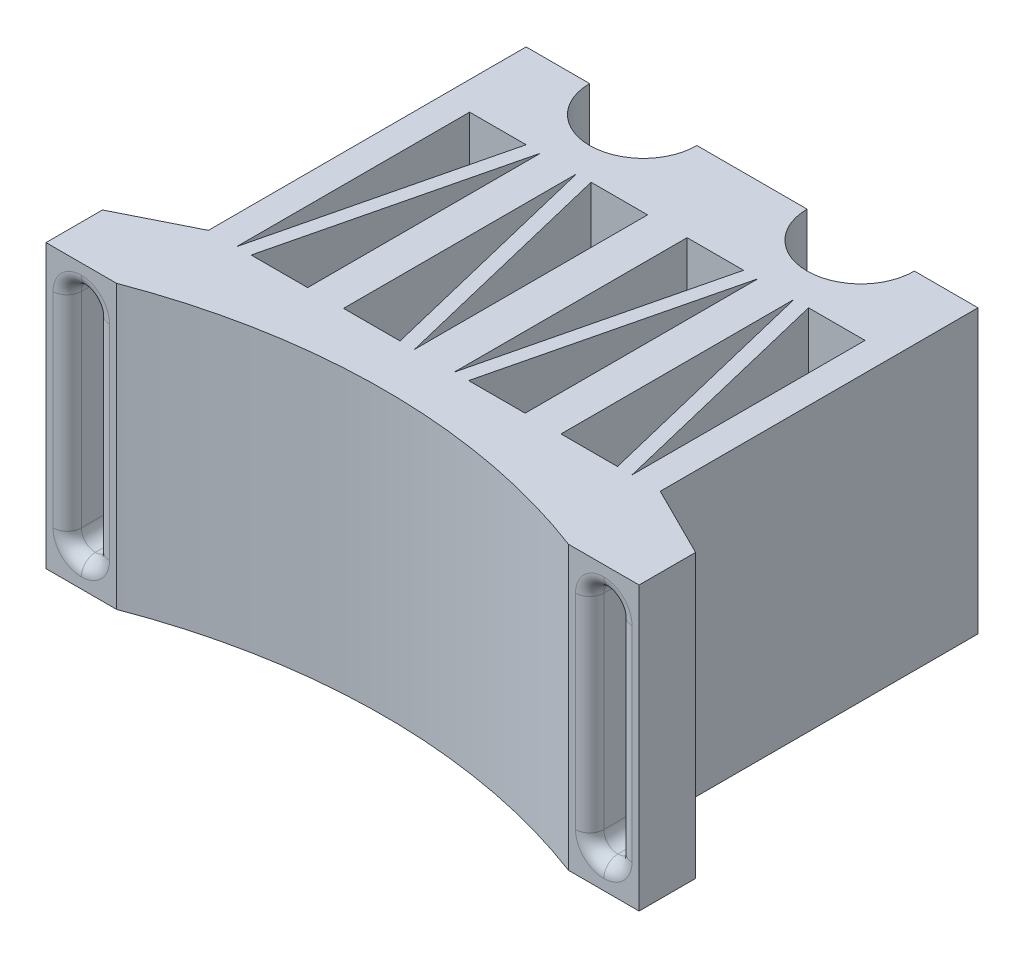
from build123d import *

# Parameters (mm, degrees)
BOSS_EXTRUDE1_DEPTH     = 50.8
SKETCH2_W               = 12.7
SKETCH2_H               = 50.8
SKETCH2_W_2             = 5.08
SKETCH2_H_2             = 41.91
BOSS_EXTRUDE2_DEPTH     = 5.08
CUT_EXTRUDE1_DEPTH      = 130.763924108
CUT_EXTRUDE1_DEPTH_BACK = 130.763924108
SKETCH5_R               = 4.0132
CUT_EXTRUDE2_DEPTH      = 12.7
BOSS_EXTRUDE3_DEPTH     = 50.8
CUT_EXTRUDE4_DEPTH      = 130.763924108
SKETCH10_W              = 5.08
SKETCH10_H              = 41.91
CUT_EXTRUDE5_DEPTH      = 127.949189836
FILLET1_R               = 2.54
FILLET2_R               = 2.54
FILLET3_R               = 2.54


with BuildPart() as part:
    # Sketch1 → Boss-Extrude1 (new body)
    with BuildSketch(Plane(origin=(0, 0, 0), x_dir=(1, 0, 0), z_dir=(0, 1, 0))):
        with BuildLine():
            Line((0, 0), (40.64, 0))
            Line((40.64, 0), (40.64, 73.66))
            Line((40.64, 73.66), (30.734, 73.66))
            ThreePointArc((30.734, 73.66), (21.082, 64.008), (11.43, 73.66))
            Line((11.43, 73.66), (0, 73.66))
            Line((0, 73.66), (0, 0))
        make_face()
        with BuildLine():
            Line((40.64, 73.66), (40.64, 0))
            Line((40.64, 0), (81.28, 0))
            Line((81.28, 0), (81.28, 73.66))
            Line((81.28, 73.66), (69.85, 73.66))
            ThreePointArc((69.85, 73.66), (60.198, 64.008), (50.546, 73.66))
            Line((50.546, 73.66), (40.64, 73.66))
        make_face()
    extrude(amount=BOSS_EXTRUDE1_DEPTH)

    # Sketch2 → Boss-Extrude2 (add)
    with BuildSketch(Plane.XY):
        with Locations((-6.35, 25.4)):
            Rectangle(SKETCH2_W, SKETCH2_H)
        with Locations((-6.35, 25.4)):
            Rectangle(SKETCH2_W_2, SKETCH2_H_2, mode=Mode.SUBTRACT)
    boss_extrude2 = extrude(amount=-BOSS_EXTRUDE2_DEPTH)

    # Mirror3: Boss-Extrude2 across plane
    add(boss_extrude2.mirror(Plane.ZY.offset(-40.64)))

    # Sketch4 → Cut-Extrude1 (cut, two sides: drawn at the far end of the back side and taken through both)
    with BuildSketch(Plane(origin=(0, 50.8, 0), x_dir=(1, 0, 0), z_dir=(0, 1, 0)).offset(-CUT_EXTRUDE1_DEPTH_BACK)):
        with BuildLine():
            Line((313.835320216, -88.467212956), (81.28, 0))
            ThreePointArc((81.28, 0), (40.64, 7.468916508), (0, 0))
            Line((0, 0), (-232.555320216, -88.467212956))
            Line((-232.555320216, -88.467212956), (-232.555320216, -586.095285833))
            Line((-232.555320216, -586.095285833), (313.835320216, -586.095285833))
            Line((313.835320216, -586.095285833), (313.835320216, -88.467212956))
        make_face()
    extrude(amount=CUT_EXTRUDE1_DEPTH + CUT_EXTRUDE1_DEPTH_BACK, mode=Mode.SUBTRACT)

    # Sketch5 → Cut-Extrude2 (cut)
    with BuildSketch(Plane(origin=(0, 0, -73.66), x_dir=(-1, 0, 0), z_dir=(0, 0, -1))):
        with Locations((-40.64, 41.91)):
            Circle(SKETCH5_R)
        with Locations(Location((-40.64, 8.89, 0), (0, 0, 180))):
            Circle(SKETCH5_R)
        with Locations((-40.64, 25.4)):
            Circle(SKETCH5_R)
    extrude(amount=-CUT_EXTRUDE2_DEPTH, mode=Mode.SUBTRACT)

    # Sketch9 → Boss-Extrude3 (add)
    with BuildSketch(Plane(origin=(0, 0, 0), x_dir=(-1, 0, 0), z_dir=(0, -1, 0))):
        Polygon((0, 5.08), (12.7, 5.08), (12.7, 10.16), (0, 16.51), (0, 8.89), align=None)
    boss_extrude3 = extrude(amount=-BOSS_EXTRUDE3_DEPTH)

    # Sketch7 → Cut-Extrude4 (cut, through all)
    with BuildSketch(Plane.XZ):
        Polygon((5.08, -16.51), (5.08, -58.42), (15.24, -58.42), align=None)
        Polygon((7.693571769, -16.51), (17.853571769, -16.51), (17.853571769, -58.42), align=None)
        Polygon((73.586428231, -16.51), (63.426428231, -16.51), (63.426428231, -58.42), align=None)
        Polygon((66.04, -58.42), (76.2, -16.51), (76.2, -58.42), align=None)
        Polygon((24.310428231, -58.42), (34.470428231, -16.51), (24.310428231, -16.51), align=None)
        Polygon((26.924, -58.42), (37.084, -16.51), (37.084, -58.42), align=None)
        Polygon((44.196, -16.51), (44.196, -58.42), (54.356, -58.42), align=None)
        Polygon((56.969571769, -58.42), (46.809571769, -16.51), (56.969571769, -16.51), align=None)
    extrude(amount=-CUT_EXTRUDE4_DEPTH, mode=Mode.SUBTRACT)

    # Sketch10 → Cut-Extrude5 (cut, through all)
    with BuildSketch(Plane.XY.offset(-5.08)):
        with Locations((-6.35, 25.4)):
            Rectangle(SKETCH10_W, SKETCH10_H)
    cut_extrude5 = extrude(amount=-CUT_EXTRUDE5_DEPTH, mode=Mode.SUBTRACT)

    # Fillet1
    fillet1_edges = [part.edges().sort_by_distance(p)[0] for p in [
        (-3.81, 46.355, -7.3025),
        (-8.89, 46.355, -6.0325),
        (-8.89, 4.445, -6.0325),
        (-3.81, 4.445, -7.3025),
    ]]
    fillet(fillet1_edges, radius=FILLET1_R - 0.0001)  # a hair under: the kernel refuses the full size

    # Mirror4: Boss-Extrude3, Cut-Extrude5 across plane
    add(boss_extrude3.mirror(Plane.ZY.offset(-40.64)))
    add(cut_extrude5.mirror(Plane.ZY.offset(-40.64)), mode=Mode.SUBTRACT)

    # Fillet2
    fillet2_edges = [part.edges().sort_by_distance(p)[0] for p in [
        (90.17, 46.355, -6.0325),
        (85.09, 46.355, -7.3025),
        (85.09, 4.445, -7.3025),
        (90.17, 4.445, -6.0325),
    ]]
    fillet(fillet2_edges, radius=FILLET2_R - 0.0001)  # a hair under: the kernel refuses the full size

    # Fillet3
    fillet3_edges = [part.edges().sort_by_distance(p)[0] for p in [
        (-3.81, 25.4, 0),
        (-8.89, 25.4, 0),
        (-4.553919486, 45.611080514, 0),
        (-8.146080514, 45.611080514, 0),
        (-8.146080514, 5.188919486, 0),
        (-4.553919486, 5.188919486, 0),
        (90.17, 25.4, 0),
        (85.09, 25.4, 0),
        (89.426080514, 45.611080514, 0),
        (85.833919486, 45.611080514, 0),
        (85.833919486, 5.188919486, 0),
        (89.426080514, 5.188919486, 0),
    ]]
    fillet(fillet3_edges, radius=FILLET3_R)


solid = part.part
